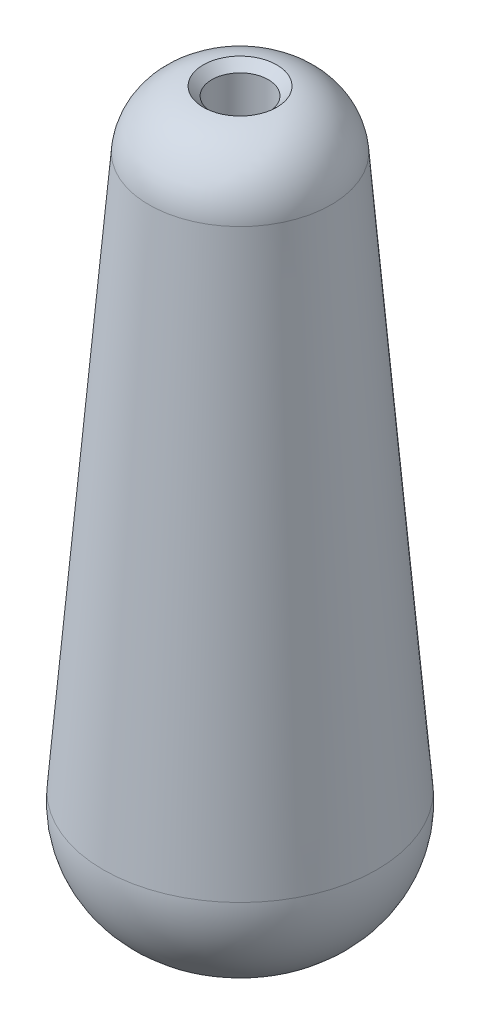
from build123d import *

# Parameters (mm, degrees)
CHANFREIN1_SIZE = 1


with BuildPart() as part:
    # Esquisse1 → Révolution1 (revolve)
    with BuildSketch(Plane.XY, mode=Mode.PRIVATE) as r_volution1_sk:
        with BuildLine():
            Line((15, 12.920103162), (10, 73.644787587))
            ThreePointArc((10, 73.644787587), (7.790381776, 78.16910476), (3.1, 80))
            Line((3.1, 80), (3.1, 4))
            Line((3.1, 4), (0, 4))
            Line((0, 4), (0, 0))
            Line((0, 0), (3.1, 0))
            ThreePointArc((3.1, 0), (11.882640061, 3.851061831), (15, 12.920103162))
        make_face()
    revolve(r_volution1_sk.sketch.rotate(Axis((0, 0, 0), (0, 1, 0)), 90), axis=Axis((0, 0, 0), (0, 1, 0)))

    # Chanfrein1
    # the kernel refuses this chamfer: 1 mm, written as the material it takes off along each edge
    with BuildSketch(Plane(origin=(0, 80, 0), x_dir=(0, 0, -1), z_dir=(1, 0, 0))) as chanfrein1_piece_1:
        with BuildLine():
            Line((4.036384624, -0.063615376), (3.1, -CHANFREIN1_SIZE))
            Line((3.1, -CHANFREIN1_SIZE), (3.1, 0))
            ThreePointArc((3.1, 0), (3.582393079, -0.016826116), (4.036384624, -0.063615376))
        make_face()
    revolve(axis=Axis((0, 80, 0), (0, 1, 0)), mode=Mode.SUBTRACT)


solid = part.part
